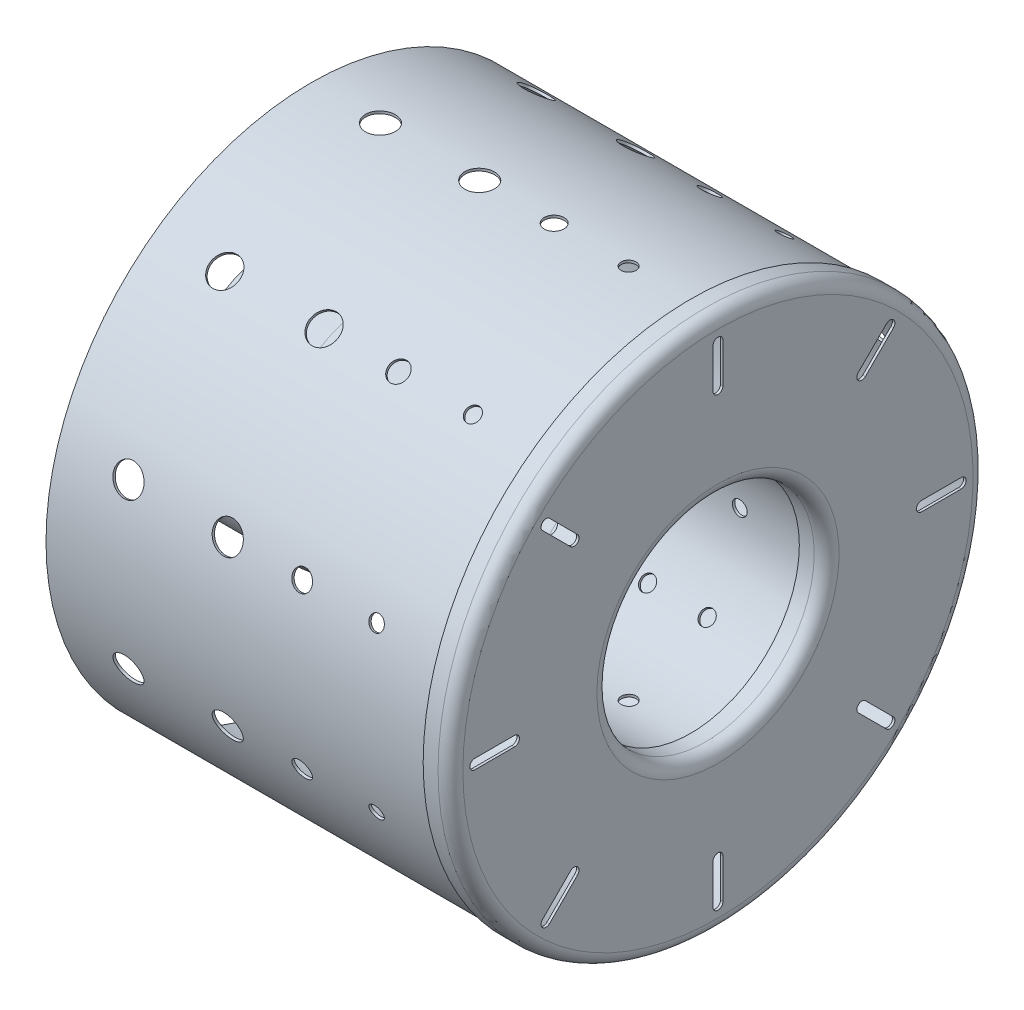
from build123d import *

# Parameters (mm, degrees)
IZIM2_R                 = 2
IZIM2_R_2               = 1.5
KES_EKSTR_ZYON2_DEPTH   = 10
DAIRESEL_KAPLAMA1_COUNT = 8
IZIM10_R                = 3
KES_EKSTR_ZYON6_DEPTH   = 4
DAIRESEL_KAPLAMA3_COUNT = 8
IZIM11_W                = 79.5
IZIM11_H                = 0.5
IZIM12_R                = 1.5
IZIM12_R_2              = 2
IZIM12_R_3              = 3
KES_EKSTR_ZYON8_DEPTH   = 4
DAIRESEL_KAPLAMA7_COUNT = 10
KES_EKSTR_ZYON9_DEPTH   = 4
DAIRESEL_KAPLAMA9_COUNT = 8


with BuildPart() as part:
    # Çizim1 → Döndür2 (revolve)
    with BuildSketch(Plane.XY):
        with BuildLine():
            Line((-44.467592593, 22.4), (-24.996573535, 22.4))
            ThreePointArc((-24.996573535, 22.4), (-24.475629002, 22.354423259), (-23.970513105, 22.219077862))
            Line((-23.970513105, 22.219077862), (-17.130373012, 19.729470471))
            ThreePointArc((-17.130373012, 19.729470471), (-16.235170744, 19.551403668), (-15.327855447, 19.650770854))
            Line((-15.327855447, 19.650770854), (-5.449092235, 22.297777479))
            ThreePointArc((-5.449092235, 22.297777479), (-5.064213676, 22.374334584), (-4.6726351, 22.4))
            Line((-4.6726351, 22.4), (40.532407407, 22.4))
            Line((40.532407407, 22.4), (40.532407407, 22.9))
            Line((40.532407407, 22.9), (-4.6726351, 22.9))
            ThreePointArc((-4.6726351, 22.9), (-5.129476773, 22.870057015), (-5.578501758, 22.780740392))
            Line((-5.578501758, 22.780740392), (-15.45726497, 20.133733767))
            ThreePointArc((-15.45726497, 20.133733767), (-16.213361051, 20.050927779), (-16.959362941, 20.199316781))
            Line((-16.959362941, 20.199316781), (-23.799503033, 22.688924173))
            ThreePointArc((-23.799503033, 22.688924173), (-24.388804913, 22.846827136), (-24.996573535, 22.9))
            Line((-24.996573535, 22.9), (-44.467592593, 22.9))
            Line((-44.467592593, 22.9), (-44.467592593, 22.4))
        make_face()
    revolve(axis=Axis((-44.467592593, 0, 0), (1, 0, 0)))

    # Çizim2 → Kes-Ekstrüzyon2 (cut)
    with BuildSketch(Plane(origin=(0, 22.9, 0), x_dir=(1, 0, 0), z_dir=(0, 1, 0))):
        with Locations((-32.467592593, 0)):
            Circle(IZIM2_R)
        with Locations((1.532407407, 0)):
            Circle(IZIM2_R)
        with Locations((13.532407407, 0)):
            Circle(IZIM2_R_2)
        with Locations((25.532407407, 0)):
            Circle(IZIM2_R_2)
    kes_ekstr_zyon2 = extrude(amount=-KES_EKSTR_ZYON2_DEPTH, mode=Mode.SUBTRACT)

    # Dairesel Kaplama1: Kes-Ekstrüzyon2 ×8 about axis
    dairesel_kaplama1_axis = Axis((40.532407407, 0, 0), (-1, 0, 0))
    for i in range(1, DAIRESEL_KAPLAMA1_COUNT):
        add(kes_ekstr_zyon2.rotate(dairesel_kaplama1_axis, i * 360 / DAIRESEL_KAPLAMA1_COUNT), mode=Mode.SUBTRACT)

    # Çizim3 → Döndür5 (revolve)
    with BuildSketch(Plane.XY):
        with BuildLine():
            Line((38.032407407, 22.4), (41.032407407, 22.4))
            ThreePointArc((41.032407407, 22.4), (42.44662097, 22.985786438), (43.032407407, 24.4))
            Line((43.032407407, 24.4), (43.032407407, 51.4))
            ThreePointArc((43.032407407, 51.4), (42.44662097, 52.814213562), (41.032407407, 53.4))
            Line((41.032407407, 53.4), (38.032407407, 53.4))
            Line((38.032407407, 53.4), (38.032407407, 53.9))
            Line((38.032407407, 53.9), (41.032407407, 53.9))
            ThreePointArc((41.032407407, 53.9), (42.80017436, 53.167766953), (43.532407407, 51.4))
            Line((43.532407407, 51.4), (43.532407407, 24.4))
            ThreePointArc((43.532407407, 24.4), (42.80017436, 22.632233047), (41.032407407, 21.9))
            Line((41.032407407, 21.9), (38.032407407, 21.9))
            Line((38.032407407, 21.9), (38.032407407, 22.4))
        make_face()
    revolve(axis=Axis((-53.494352744, 0, 0), (1, 0, 0)))

    # Çizim10 → Kes-Ekstrüzyon6 (cut)
    with BuildSketch(Plane(origin=(4.508066675, -12.385811395, 0), x_dir=(-0.9396926207859082, -0.3420201433256695, 0), z_dir=(0.3420201433256695, -0.9396926207859082, 0))):
        with Locations((26.323257814, 0)):
            Circle(IZIM10_R)
    kes_ekstr_zyon6 = extrude(amount=-KES_EKSTR_ZYON6_DEPTH, mode=Mode.SUBTRACT)

    # Dairesel Kaplama3: Kes-Ekstrüzyon6 ×8 about axis
    dairesel_kaplama3_axis = Axis((-44.467592593, 0, 0), (-1, 0, 0))
    for i in range(1, DAIRESEL_KAPLAMA3_COUNT):
        add(kes_ekstr_zyon6.rotate(dairesel_kaplama3_axis, i * 360 / DAIRESEL_KAPLAMA3_COUNT), mode=Mode.SUBTRACT)

    # Çizim11 → Döndür6 (revolve)
    with BuildSketch(Plane.XY):
        with Locations((1.282407407, 53.15)):
            Rectangle(IZIM11_W, IZIM11_H)
    revolve(axis=Axis((-56.732835394, 0, 0), (1, 0, 0)))

    # Çizim12 → Kes-Ekstrüzyon8 (cut)
    with BuildSketch(Plane(origin=(0, -53.4, 0), x_dir=(-1, 0, 0), z_dir=(0, -1, 0))):
        with Locations((-25.532407407, 0)):
            Circle(IZIM12_R)
        with Locations((-10.532407407, 0)):
            Circle(IZIM12_R_2)
        with Locations((4.467592593, 0)):
            Circle(IZIM12_R_3)
        with Locations((24.467592593, 0)):
            Circle(IZIM12_R_3)
    kes_ekstr_zyon8 = extrude(amount=-KES_EKSTR_ZYON8_DEPTH, mode=Mode.SUBTRACT)

    # Dairesel Kaplama7: Kes-Ekstrüzyon8 ×10 about axis
    dairesel_kaplama7_axis = Axis((-38.467592593, 0, 0), (-1, 0, 0))
    for i in range(1, DAIRESEL_KAPLAMA7_COUNT):
        add(kes_ekstr_zyon8.rotate(dairesel_kaplama7_axis, i * 360 / DAIRESEL_KAPLAMA7_COUNT), mode=Mode.SUBTRACT)

    # Çizim16 → Kes-Ekstrüzyon9 (cut)
    with BuildSketch(Plane(origin=(43.532407407, 0, 0), x_dir=(0, 0, -1), z_dir=(1, 0, 0))):
        with BuildLine():
            Line((1, 49), (1, 41))
            ThreePointArc((1, 41), (0, 40), (-1, 41))
            Line((-1, 41), (-1, 49))
            ThreePointArc((-1, 49), (0, 50), (1, 49))
        make_face()
    kes_ekstr_zyon9 = extrude(amount=-KES_EKSTR_ZYON9_DEPTH, mode=Mode.SUBTRACT)

    # Dairesel Kaplama9: Kes-Ekstrüzyon9 ×8 about axis
    dairesel_kaplama9_axis = Axis((43.532407407, 0, 0), (-1, 0, 0))
    for i in range(1, DAIRESEL_KAPLAMA9_COUNT):
        add(kes_ekstr_zyon9.rotate(dairesel_kaplama9_axis, i * 360 / DAIRESEL_KAPLAMA9_COUNT), mode=Mode.SUBTRACT)


solid = part.part
